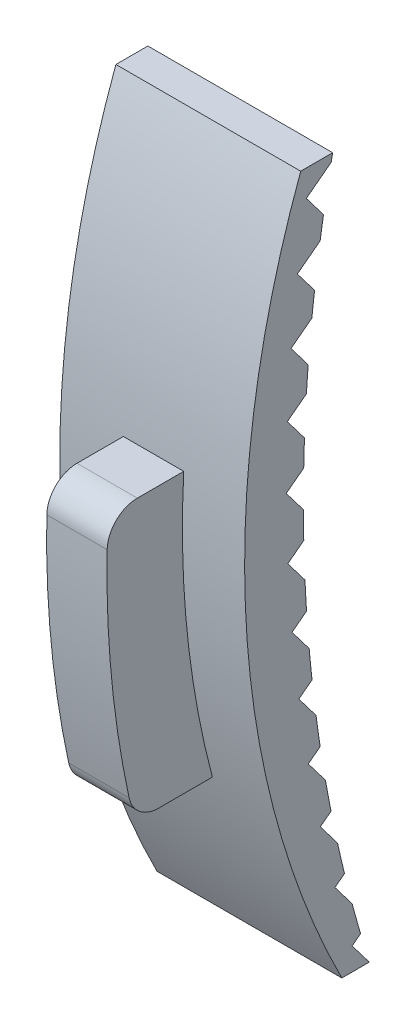
from build123d import *

# Parameters (mm, degrees)
BOSS_EXTRUDE1_DEPTH      = 76.2
SKETCH2_W                = 6.985
SKETCH2_H                = 9.525
CUT_EXTRUDE1_DEPTH       = 119.84173867
CUT_EXTRUDE2_DEPTH       = 119.84173867
CUT_EXTRUDE3_DEPTH       = 119.84173867
FILLET1_R                = 2.54
CUT_EXTRUDE4_DEPTH       = 5.08
CUT_EXTRUDE6_DEPTH       = 15.113
FILLET2_R                = 0.508
BOSS_EXTRUDE3_DEPTH      = 31.115
BOSS_EXTRUDE4_DEPTH      = 5.08
CUT_EXTRUDE7_DEPTH       = 85.888967529
CRVPATTERN3_START        = 20.1179377
CRVPATTERN3_OUTLINE_W    = 31.115
CRVPATTERN3_OUTLINE_H    = 7.094089262
CRVPATTERN3_DEPTH        = 4.784345088
CRVPATTERN3_START_2      = 12.248105014
CRVPATTERN3_2_OUTLINE_W  = 31.115
CRVPATTERN3_2_OUTLINE_H  = 6.763167552
CRVPATTERN3_2_DEPTH      = 4.784345087
CRVPATTERN3_START_3      = 4.095774155
CRVPATTERN3_3_OUTLINE_W  = 31.115
CRVPATTERN3_3_OUTLINE_H  = 6.419828923
CRVPATTERN3_3_DEPTH      = 4.784345087
CRVPATTERN3_START_4      = -4.324087509
CRVPATTERN3_4_OUTLINE_W  = 31.115
CRVPATTERN3_4_OUTLINE_H  = 6.064703736
CRVPATTERN3_4_DEPTH      = 4.784345087
CRVPATTERN3_START_5      = 27.690823503
CRVPATTERN3_5_OUTLINE_W  = 31.115
CRVPATTERN3_5_OUTLINE_H  = 6.047255266
CRVPATTERN3_5_DEPTH      = 4.784345088
CRVPATTERN3_START_6      = -12.996021434
CRVPATTERN3_6_OUTLINE_W  = 31.115
CRVPATTERN3_6_OUTLINE_H  = 5.698443985
CRVPATTERN3_6_DEPTH      = 4.784345087
CRVPATTERN3_START_7      = -21.904106282
CRVPATTERN3_7_OUTLINE_W  = 31.115
CRVPATTERN3_7_OUTLINE_H  = 5.321722107
CRVPATTERN3_7_DEPTH      = 4.784345088
CRVPATTERN3_START_8      = -31.031987149
CRVPATTERN3_8_OUTLINE_W  = 31.115
CRVPATTERN3_8_OUTLINE_H  = 4.935229754
CRVPATTERN3_8_DEPTH      = 4.784345087
CRVPATTERN3_START_9      = -40.362905596
CRVPATTERN3_9_OUTLINE_W  = 31.115
CRVPATTERN3_9_OUTLINE_H  = 4.539676505
CRVPATTERN3_9_DEPTH      = 4.784345087
CRVPATTERN3_START_10     = -49.879730415
CRVPATTERN3_10_OUTLINE_W = 31.115
CRVPATTERN3_10_OUTLINE_H = 4.135788586
CRVPATTERN3_10_DEPTH     = 4.784345088
CRVPATTERN3_START_11     = -59.564989077
CRVPATTERN3_11_OUTLINE_W = 31.115
CRVPATTERN3_11_OUTLINE_H = 3.724307516
CRVPATTERN3_11_DEPTH     = 4.784345087
FILLET3_R                = 5.08


# Read off the part's stored shape, not the designer's step: CrvPattern3
with BuildPart() as part:
    # Sketch1 → Boss-Extrude1 (new body)
    with BuildSketch(Plane.XY):
        Polygon((-15.5575, 76.2), (15.5575, 76.2), (15.5575, -76.2), (7.845485509, -76.2), (9.525, -85.725), (-9.525, -85.725), (-7.845485509, -76.2), (-15.5575, -76.2), align=None)
    extrude(amount=BOSS_EXTRUDE1_DEPTH)

    # Sketch2 → Cut-Extrude1 (cut, through all)
    with BuildSketch(Plane(origin=(15.5575, 0, 0), x_dir=(0, 0, -1), z_dir=(1, 0, 0))):
        with Locations((-3.4925, -80.9625)):
            Rectangle(SKETCH2_W, SKETCH2_H)
    extrude(amount=-CUT_EXTRUDE1_DEPTH, mode=Mode.SUBTRACT)

    # Sketch3 → Cut-Extrude2 (cut, through all)
    with BuildSketch(Plane(origin=(15.5575, 0, 0), x_dir=(0, 0, -1), z_dir=(1, 0, 0))):
        with BuildLine():
            Line((-76.2, -85.725), (-76.2, -76.2))
            Line((-76.2, -76.2), (-76.2, 76.2))
            Line((-76.2, 76.2), (-6.541803462, 76.2))
            ThreePointArc((-6.541803462, 76.2), (-58.046669251, 2.411215556), (-76.2, -85.725))
        make_face()
        with BuildLine():
            Line((0, -76.2), (0, 67.75939176))
            ThreePointArc((0, 67.75939176), (-18.20597202, -4.22030412), (0, -76.2))
        make_face()
    extrude(amount=-CUT_EXTRUDE2_DEPTH, mode=Mode.SUBTRACT)

    # Sketch6 → Cut-Extrude3 (cut, through all)
    with BuildSketch(Plane(origin=(15.5575, 0, 0), x_dir=(0, 0, -1), z_dir=(1, 0, 0))):
        with BuildLine():
            ThreePointArc((-28.934409948, -61.883434575), (-23.879909813, -60.517759582), (-22.716254779, -55.412963136))
            ThreePointArc((-22.716254779, -55.412963136), (-30.753414225, -11.294498854), (-26.546552055, 33.352305435))
            ThreePointArc((-26.546552055, 33.352305435), (-49.181053892, -9.446405872), (-61.429710833, -56.286781256))
            ThreePointArc((-61.429710833, -56.286781256), (-59.737369376, -60.827463042), (-55.008021131, -61.883434575))
            ThreePointArc((-55.008021131, -61.883434575), (-41.971215539, -60.062859411), (-28.934409948, -61.883434575))
        make_face()
    extrude(amount=-CUT_EXTRUDE3_DEPTH, mode=Mode.SUBTRACT)

    # Fillet1
    fillet1_edges = [part.edges().sort_by_distance(p)[0] for p in [
        (0, 33.352305435, 26.546552055),
    ]]
    fillet(fillet1_edges, radius=FILLET1_R)

    # Sketch7 → Cut-Extrude4 (cut, symmetric)
    with BuildSketch(Plane(origin=(0, 0, 0), x_dir=(0, 0, -1), z_dir=(1, 0, 0))):
        with BuildLine():
            Line((-30.699128799, 4.016230293), (-17.981752538, 4.016230293))
            ThreePointArc((-17.981752538, 4.016230293), (-17.415803594, -19.667907964), (-13.161921654, -42.973769707))
            Line((-13.161921654, -42.973769707), (-26.264177108, -42.973769707))
            ThreePointArc((-26.264177108, -42.973769707), (-30.179968378, -19.639057999), (-30.699128799, 4.016230293))
        make_face()
    extrude(amount=CUT_EXTRUDE4_DEPTH, both=True, mode=Mode.SUBTRACT)

    # Sketch10 → Cut-Extrude6 (cut, symmetric)
    with BuildSketch(Plane(origin=(15.5575, 76.2, 6.541803462), x_dir=(-1, 0, 0), z_dir=(0, -0.7903999954772005, -0.6125910929401777))):
        Polygon((0, 5.170641427), (6.985, 5.170641427), (0, -3.655858573), align=None)
        Polygon((31.115, 5.170641427), (31.115, -3.655858573), (24.13, 5.170641427), align=None)
    extrude(amount=CUT_EXTRUDE6_DEPTH, both=True, mode=Mode.SUBTRACT)

    # Fillet2
    fillet2_edges = [part.edges().sort_by_distance(p)[0] for p in [
        (0, 76.2, 6.541803462),
        (-14.111333502, 74.930435776, 7.871138317),
        (14.111333502, 74.930435776, 7.871138317),
        (-15.5575, 5.090891194, 56.873019023),
        (15.5575, 5.090891194, 56.873019023),
    ]]
    fillet(fillet2_edges, radius=FILLET2_R)


with BuildPart() as body_2:
    # Sketch11 → Boss-Extrude3 (new body)
    with BuildSketch(Plane(origin=(15.5575, 0, 0), x_dir=(0, 0, -1), z_dir=(1, 0, 0))):
        with BuildLine():
            Line((-8.76443151, 48.407010808), (-3.38019913, 48.407010808))
            ThreePointArc((-3.38019913, 48.407010808), (-7.998658724, -12.530018981), (2.784381833, -72.682972398))
            Line((2.784381833, -72.682972398), (-1.84156903, -72.682972398))
            ThreePointArc((-1.84156903, -72.682972398), (-17.95915827, -12.861548832), (-8.76443151, 48.407010808))
        make_face()
    extrude(amount=-BOSS_EXTRUDE3_DEPTH)


with BuildPart() as body_3:
    # Sketch13 → Boss-Extrude4 (new, symmetric)
    with BuildSketch(Plane(origin=(0, 0, 0), x_dir=(0, 0, -1), z_dir=(1, 0, 0))):
        with BuildLine():
            Line((-13.161921654, -42.973769707), (-26.264177108, -42.973769707))
            ThreePointArc((-26.264177108, -42.973769707), (-30.179968378, -19.639057999), (-30.699128799, 4.016230293))
            Line((-30.699128799, 4.016230293), (-17.981752538, 4.016230293))
            ThreePointArc((-17.981752538, 4.016230293), (-17.415803594, -19.667907964), (-13.161921654, -42.973769707))
        make_face()
    extrude(amount=BOSS_EXTRUDE4_DEPTH, both=True)


with BuildPart() as body_2_1:
    add(body_2.part)

    # Combine1: union body 3
    add(body_3.part)

    # Sketch14 → Cut-Extrude7 (cut, through all)
    with BuildSketch(Plane(origin=(15.5575, 0, 0), x_dir=(0, 0, -1), z_dir=(1, 0, 0))):
        Polygon((-3.636956276, 47.137010808), (-0.743194378, 43.327010808), (-4.923479567, 40.152010808), (-7.817241465, 43.962010808), align=None)
    extrude(amount=-CUT_EXTRUDE7_DEPTH, mode=Mode.SUBTRACT)

    # CrvPattern3 outline → CrvPattern3 (cut)
    with BuildSketch(Plane(origin=(0, 0, 0), x_dir=(1, 0, 0), z_dir=(0, 0.7963472387815729, 0.604839710406786)).offset(CRVPATTERN3_START)):
        with Locations((0, 9.405700103)):
            Rectangle(CRVPATTERN3_OUTLINE_W, CRVPATTERN3_OUTLINE_H)
    extrude(amount=CRVPATTERN3_DEPTH, mode=Mode.SUBTRACT)

    # CrvPattern3 2 outline → CrvPattern3 2 (cut)
    with BuildSketch(Plane(origin=(0, 0, 0), x_dir=(1, 0, 0), z_dir=(0, 0.7963472387815729, 0.604839710406786)).offset(CRVPATTERN3_START_2)):
        with Locations((0, 2.477071696)):
            Rectangle(CRVPATTERN3_2_OUTLINE_W, CRVPATTERN3_2_OUTLINE_H)
    extrude(amount=CRVPATTERN3_2_DEPTH, mode=Mode.SUBTRACT)

    # CrvPattern3 3 outline → CrvPattern3 3 (cut)
    with BuildSketch(Plane(origin=(0, 0, 0), x_dir=(1, 0, 0), z_dir=(0, 0.7963472387815729, 0.604839710406786)).offset(CRVPATTERN3_START_3)):
        with Locations((0, -4.114426542)):
            Rectangle(CRVPATTERN3_3_OUTLINE_W, CRVPATTERN3_3_OUTLINE_H)
    extrude(amount=CRVPATTERN3_3_DEPTH, mode=Mode.SUBTRACT)

    # CrvPattern3 4 outline → CrvPattern3 4 (cut)
    with BuildSketch(Plane(origin=(0, 0, 0), x_dir=(1, 0, 0), z_dir=(0, 0.7963472387815729, 0.604839710406786)).offset(CRVPATTERN3_START_4)):
        with Locations((0, -10.356692871)):
            Rectangle(CRVPATTERN3_4_OUTLINE_W, CRVPATTERN3_4_OUTLINE_H)
    extrude(amount=CRVPATTERN3_4_DEPTH, mode=Mode.SUBTRACT)

    # CrvPattern3 5 outline → CrvPattern3 5 (cut)
    with BuildSketch(Plane(origin=(0, 0, 0), x_dir=(1, 0, 0), z_dir=(0, 0.7963472387815729, 0.604839710406786)).offset(CRVPATTERN3_START_5)):
        with Locations((0, 15.976372367)):
            Rectangle(CRVPATTERN3_5_OUTLINE_W, CRVPATTERN3_5_OUTLINE_H)
    extrude(amount=CRVPATTERN3_5_DEPTH, mode=Mode.SUBTRACT)

    # CrvPattern3 6 outline → CrvPattern3 6 (cut)
    with BuildSketch(Plane(origin=(0, 0, 0), x_dir=(1, 0, 0), z_dir=(0, 0.7963472387815729, 0.604839710406786)).offset(CRVPATTERN3_START_6)):
        with Locations((0, -16.238266732)):
            Rectangle(CRVPATTERN3_6_OUTLINE_W, CRVPATTERN3_6_OUTLINE_H)
    extrude(amount=CRVPATTERN3_6_DEPTH, mode=Mode.SUBTRACT)

    # CrvPattern3 7 outline → CrvPattern3 7 (cut)
    with BuildSketch(Plane(origin=(0, 0, 0), x_dir=(1, 0, 0), z_dir=(0, 0.7963472387815729, 0.604839710406786)).offset(CRVPATTERN3_START_7)):
        with Locations((0, -21.748349778)):
            Rectangle(CRVPATTERN3_7_OUTLINE_W, CRVPATTERN3_7_OUTLINE_H)
    extrude(amount=CRVPATTERN3_7_DEPTH, mode=Mode.SUBTRACT)

    # CrvPattern3 8 outline → CrvPattern3 8 (cut)
    with BuildSketch(Plane(origin=(0, 0, 0), x_dir=(1, 0, 0), z_dir=(0, 0.7963472387815729, 0.604839710406786)).offset(CRVPATTERN3_START_8)):
        with Locations((0, -26.876825708)):
            Rectangle(CRVPATTERN3_8_OUTLINE_W, CRVPATTERN3_8_OUTLINE_H)
    extrude(amount=CRVPATTERN3_8_DEPTH, mode=Mode.SUBTRACT)

    # CrvPattern3 9 outline → CrvPattern3 9 (cut)
    with BuildSketch(Plane(origin=(0, 0, 0), x_dir=(1, 0, 0), z_dir=(0, 0.7963472387815729, 0.604839710406786)).offset(CRVPATTERN3_START_9)):
        with Locations((0, -31.614278838)):
            Rectangle(CRVPATTERN3_9_OUTLINE_W, CRVPATTERN3_9_OUTLINE_H)
    extrude(amount=CRVPATTERN3_9_DEPTH, mode=Mode.SUBTRACT)

    # CrvPattern3 10 outline → CrvPattern3 10 (cut)
    with BuildSketch(Plane(origin=(0, 0, 0), x_dir=(1, 0, 0), z_dir=(0, 0.7963472387815729, 0.604839710406786)).offset(CRVPATTERN3_START_10)):
        with Locations((0, -35.952011383)):
            Rectangle(CRVPATTERN3_10_OUTLINE_W, CRVPATTERN3_10_OUTLINE_H)
    extrude(amount=CRVPATTERN3_10_DEPTH, mode=Mode.SUBTRACT)

    # CrvPattern3 11 outline → CrvPattern3 11 (cut)
    with BuildSketch(Plane(origin=(0, 0, 0), x_dir=(1, 0, 0), z_dir=(0, 0.7963472387815729, 0.604839710406786)).offset(CRVPATTERN3_START_11)):
        with Locations((0, -39.882059434)):
            Rectangle(CRVPATTERN3_11_OUTLINE_W, CRVPATTERN3_11_OUTLINE_H)
    extrude(amount=CRVPATTERN3_11_DEPTH, mode=Mode.SUBTRACT)

    # Fillet3
    fillet3_edges = [body_2_1.edges().sort_by_distance(p)[0] for p in [
        (0, 4.016230293, 30.699128799),
        (0, -42.973769707, 26.264177108),
    ]]
    fillet(fillet3_edges, radius=FILLET3_R)


solid = body_2_1.part
